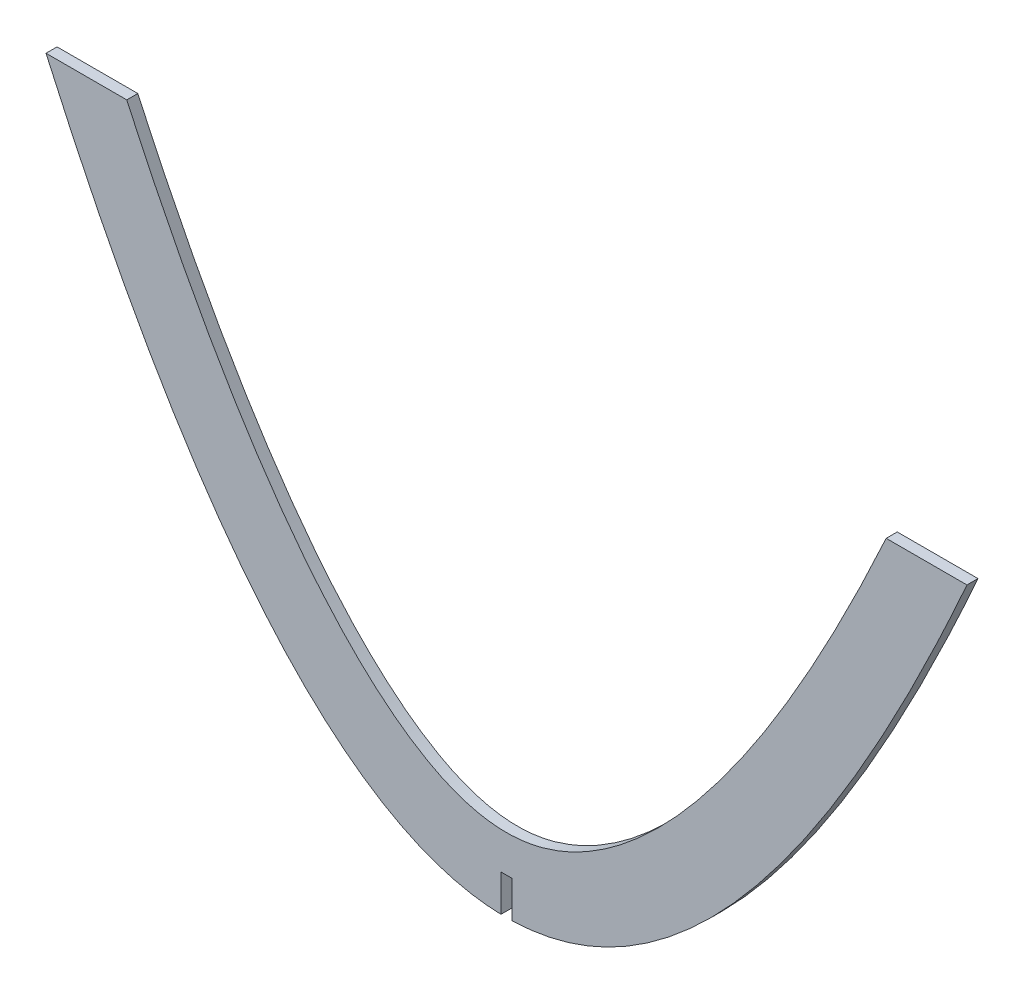
from build123d import *

# Parameters (mm, degrees)
BOSS_EXTRUDE1_DEPTH = 3
SKETCH2_W           = 3
SKETCH2_H           = 14.324437629
CUT_EXTRUDE1_DEPTH  = 13


# Read off the part's stored shape, not the designer's step: Boss-Extrude1
with BuildPart() as part:
    # Boss-Extrude1 outline → Boss-Extrude1 (new body)
    with BuildSketch(Plane.XY):
        with BuildLine():
            Line((125.077753595, 140.799999999), (103.138713338, 140.799999999))
            add(Edge.make_bspline(
                [(103.138713338, 140.799999999), (93.542146278, 119.847471898), (72.808653967, 81.938719065), (50.916611333, 51.236700067), (33.870460098, 34.505911397), (21.289730771, 25.712869222), (11.472405571, 21.616258487), (5.010806556, 20.261029403), (-1.7438e-05, 19.910029363), (-5.010839163, 20.261027839), (-11.472453528, 21.616254055), (-21.289588116, 25.712871213), (-33.871531711, 34.505848314), (-47.501408239, 47.890829337), (-61.817933067, 65.995643553), (-76.566426388, 88.807898183), (-93.541811929, 119.847096454), (-103.138713338, 140.800000001)],
                knots=[0.067755266, 0.067755266, 0.067755266, 0.137934979, 0.221488445, 0.305041912, 0.360744223, 0.416446534, 0.458223267, 0.486074422, 0.513925578, 0.541776733, 0.583553466, 0.639255777, 0.694958088, 0.750660399, 0.80636271, 0.862065021, 0.932245043, 0.932245043, 0.932245043], degree=2))
            Line((-103.138713338, 140.800000001), (-125.077753596, 140.800000001))
            add(Edge.make_bspline(
                [(-125.077753596, 140.800000001), (0, -140.8), (125.077753595, 140.799999999)],
                knots=[0.054381513, 0.054381513, 0.054381513, 0.945618487, 0.945618487, 0.945618487], degree=2))
        make_face()
    extrude(amount=BOSS_EXTRUDE1_DEPTH)

    # Sketch2 → Cut-Extrude1 (cut)
    with BuildSketch(Plane.XY):
        with Locations((0, 2.837781185)):
            Rectangle(SKETCH2_W, SKETCH2_H)
    extrude(amount=CUT_EXTRUDE1_DEPTH, mode=Mode.SUBTRACT)


solid = part.part
